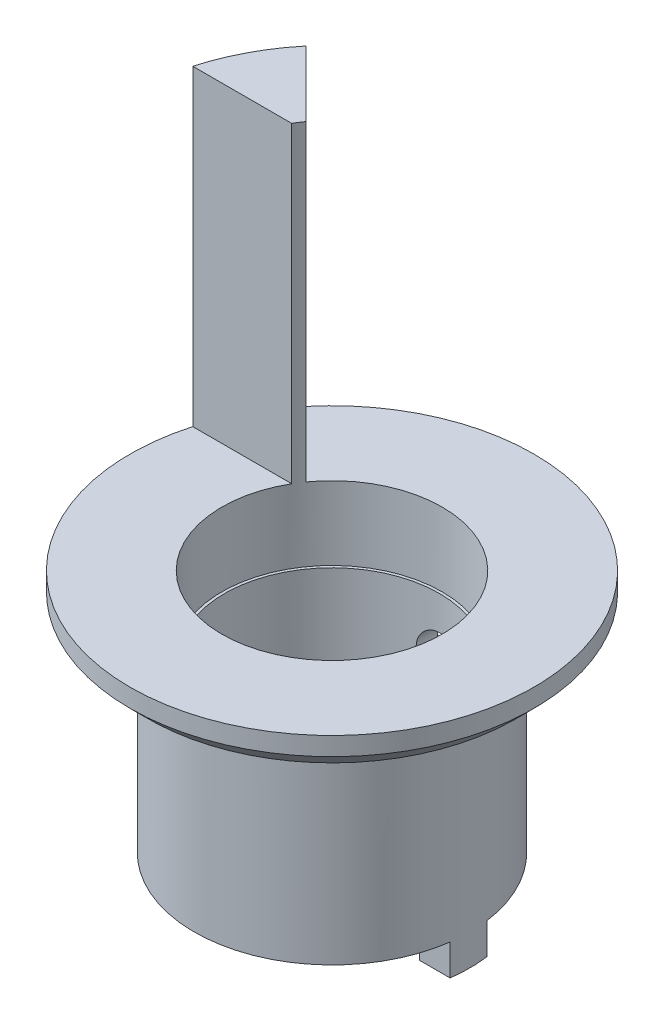
from build123d import *

# Parameters (mm, degrees)
CUT_EXTRUDE_2_DEPTH      = 17
CHAMFER_1_SIZE           = 1
SKETCH_5_OUTSIDE_W       = 32.926
SKETCH_5_OUTSIDE_H       = 32.926
CUT_EXTRUDE_4_DEPTH      = 1.7
CUT_EXTRUDE_5_DEPTH      = 36.580893749
CUT_EXTRUDE_5_DEPTH_BACK = 36.580893749


# Read off the part's stored shape, not the designer's step: Диаметр отверстия Ø2.3 (2.3)1
with BuildPart() as part:
    # Эскиз1 → Повернуть1 (revolve)
    with BuildSketch(Plane.XY, mode=Mode.PRIVATE) as revolve_1_sk:
        Polygon((5.85, 0), (5.85, 11), (6, 11), (6, 32), (11, 32), (11, 13), (7.5, 13), (7.5, 0), align=None)
    revolve(revolve_1_sk.sketch.rotate(Axis((0, 0, 0), (0, 1, 0)), 90), axis=Axis((0, 0, 0), (0, 1, 0)))

    # Эскиз2 → Вырез-Вытянуть2 (cut)
    with BuildSketch(Plane(origin=(0, 32, 0), x_dir=(1, 0, 0), z_dir=(0, 1, 0))):
        with BuildLine():
            Line((-5.196152423, 3), (-10.583005244, 3))
            ThreePointArc((-10.583005244, 3), (-1.514421063, -10.895252583), (11, 0))
            ThreePointArc((11, 0), (3.74273909, 10.343689096), (-8.453073474, 7.038859911))
            Line((-8.453073474, 7.038859911), (-4.890406914, 3.476193351))
            ThreePointArc((-4.890406914, 3.476193351), (1.824494247, 5.715874451), (6, 0))
            ThreePointArc((6, 0), (-1.552914271, -5.795554958), (-5.196152423, 3))
        make_face()
    extrude(amount=-CUT_EXTRUDE_2_DEPTH, mode=Mode.SUBTRACT)

    # Фаска1
    chamfer_1_edges = [part.edges().sort_by_distance(p)[0] for p in [
        (0, 13, 11),
    ]]
    chamfer(chamfer_1_edges, length=CHAMFER_1_SIZE)

    # Эскиз5 outside → Вырез-Вытянуть4 (cut)
    with BuildSketch(Plane.XZ):
        Rectangle(SKETCH_5_OUTSIDE_W, SKETCH_5_OUTSIDE_H)
        with BuildLine():
            Line((0, 0), (3.954322794, 1))
            Line((3.954322794, 1), (7.433034374, 1))
            ThreePointArc((7.433034374, 1), (7.5, 0), (7.433034374, -1))
            Line((7.433034374, -1), (3.955330555, -1))
            Line((3.955330555, -1), (0, 0))
        make_face(mode=Mode.SUBTRACT)
    extrude(amount=-CUT_EXTRUDE_4_DEPTH, mode=Mode.SUBTRACT)

    # Эскиз6 → Вырез-Вытянуть5 (cut, two sides: drawn at the far end of the back side and taken through both)
    with BuildSketch(Plane(origin=(0, 0, 0), x_dir=(0, 0, -1), z_dir=(1, 0, 0)).offset(-CUT_EXTRUDE_5_DEPTH_BACK)):
        Polygon((82.137450445, 10.5), (7.5, 10.5), (7, 10.5), (7, 5.5), (7.5, 5.5), (82.137450445, 5.5), (231.412351334, 5.5), (231.412351334, 10.5), align=None)
    extrude(amount=CUT_EXTRUDE_5_DEPTH + CUT_EXTRUDE_5_DEPTH_BACK, mode=Mode.SUBTRACT)

    # Диаметр отверстия Ø2.3 (2.3)1 outline → Диаметр отверстия Ø2.3 (2.3)1 (revolve, cut)
    with BuildSketch(Plane.XZ.offset(-8)):
        Polygon((1.15, -6.9), (1.15, -5.735802951), (0, -5.735802951), (0, -7), (1.25, -7), align=None)
    revolve(axis=Axis((0, 8, 0), (0, 0, 1)), mode=Mode.SUBTRACT)


solid = part.part
